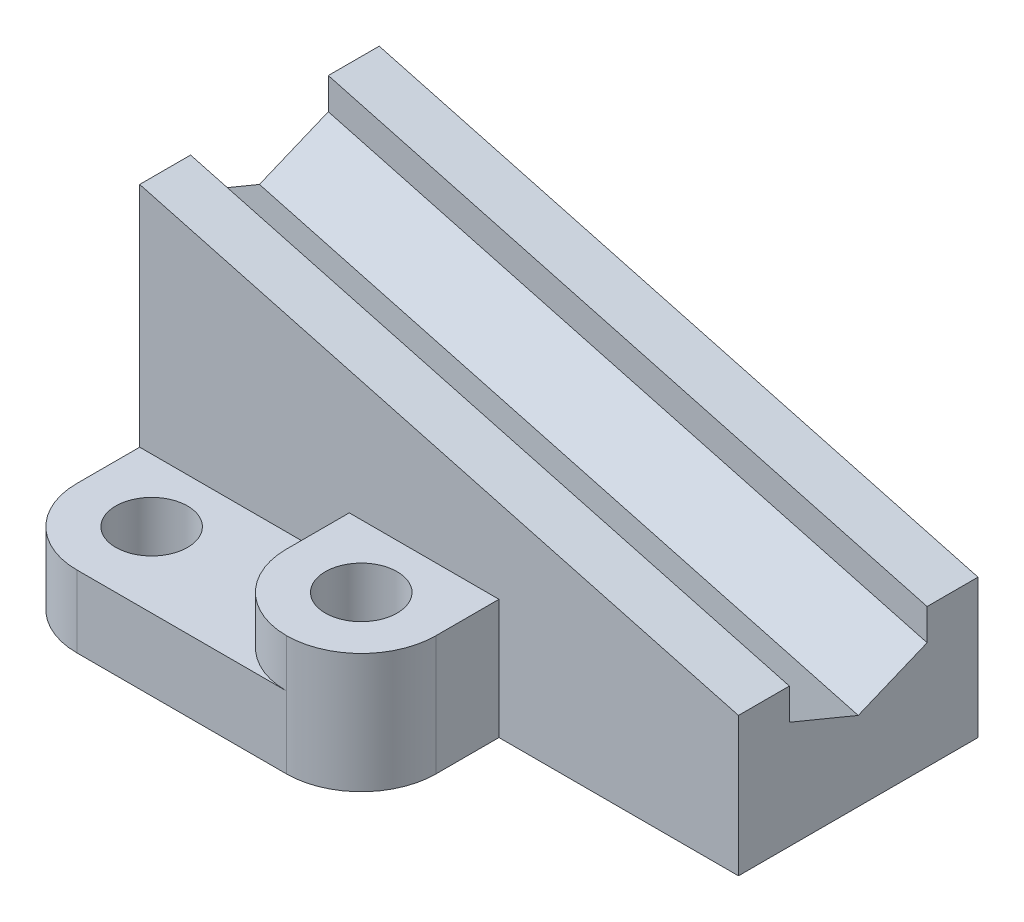
from build123d import *

# Parameters (mm, degrees)
SKETCH1_W                            = 100
SKETCH1_H                            = 40
BOSS_EXTRUDE1_DEPTH                  = 50
SKETCH1_4_W                          = 35
SKETCH1_4_H                          = 23
BOSS_EXTRUDE2_DEPTH                  = 12
SKETCH1_5_W                          = 25
SKETCH1_5_H                          = 23
BOSS_EXTRUDE3_DEPTH                  = 20
FILLET1_R                            = 12.5
CUT_EXTRUDE1_DEPTH                   = 119.74342087
CUT_EXTRUDE2_DEPTH                   = 123.967511388
F_12_0_12_DIAMETER_HOLE1_D           = 12
F_12_0_12_DIAMETER_HOLE1_ON_FACE_2_D = 12


with BuildPart() as part:
    # Sketch1 → Boss-Extrude1 (new body)
    with BuildSketch(Plane(origin=(0, 0, 0), x_dir=(1, 0, 0), z_dir=(0, 1, 0))):
        with Locations((50, 20)):
            Rectangle(SKETCH1_W, SKETCH1_H)
    extrude(amount=BOSS_EXTRUDE1_DEPTH)

    # Sketch1<4> → Boss-Extrude2 (add)
    with BuildSketch(Plane(origin=(0, 0, 0), x_dir=(1, 0, 0), z_dir=(0, 1, 0))):
        with Locations((17.5, -11.5)):
            Rectangle(SKETCH1_4_W, SKETCH1_4_H)
    extrude(amount=BOSS_EXTRUDE2_DEPTH)

    # Sketch1<5> → Boss-Extrude3 (add)
    with BuildSketch(Plane(origin=(0, 0, 0), x_dir=(1, 0, 0), z_dir=(0, 1, 0))):
        with Locations((47.5, -11.5)):
            Rectangle(SKETCH1_5_W, SKETCH1_5_H)
    extrude(amount=BOSS_EXTRUDE3_DEPTH)

    # Fillet1
    fillet1_edges = [part.edges().sort_by_distance(p)[0] for p in [
        (60, 10, 23),
        (35, 16, 23),
        (0, 6, 23),
    ]]
    fillet(fillet1_edges, radius=FILLET1_R - 0.0001)  # a hair under: the kernel refuses the full size

    # Sketch2 → Cut-Extrude1 (cut, through all)
    with BuildSketch(Plane.XY):
        Polygon((0, 50), (100, 23.205080757), (100, 50), align=None)
    extrude(amount=-CUT_EXTRUDE1_DEPTH, mode=Mode.SUBTRACT)

    # Sketch4 → Cut-Extrude2 (cut, through all, along a direction that is not the sketch's normal)
    with BuildSketch(Plane.ZY):
        Polygon((-31.5, 50), (-31.5, 44.763455967), (-20, 40), (-8.5, 44.763455967), (-8.5, 50), align=None)
    extrude(amount=-CUT_EXTRUDE2_DEPTH, dir=(-0.9659258262890701, 0.2588190451025143, 0), mode=Mode.SUBTRACT)

    # Ø12.0 (12) Diameter Hole1 (through all)
    with Locations(Plane(origin=(12.5, 12, 10.5), x_dir=(0, 0, 1), z_dir=(0, 1, 0))):
        with Locations((0, 0)):
            Hole(F_12_0_12_DIAMETER_HOLE1_D / 2)

    # Ø12.0 (12) Diameter Hole1 on face 2 (through all)
    with Locations(Plane(origin=(47.5, 20, 10.5), x_dir=(0, 0, 1), z_dir=(0, 1, 0))):
        with Locations((0, 0)):
            Hole(F_12_0_12_DIAMETER_HOLE1_ON_FACE_2_D / 2)


solid = part.part
